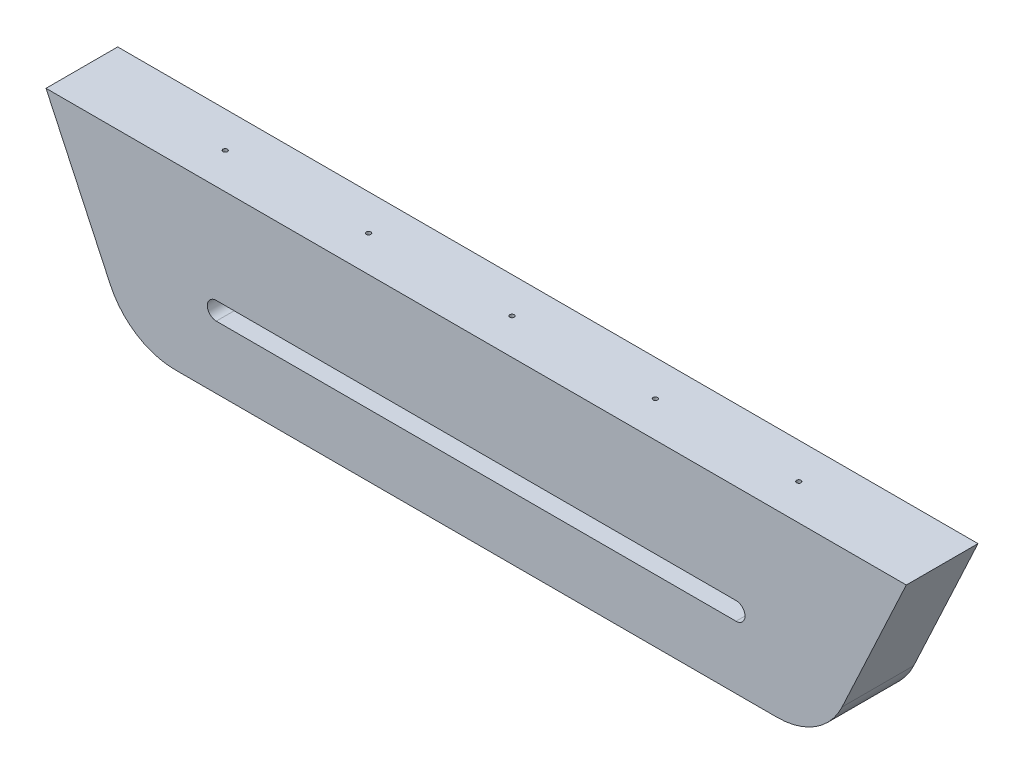
from build123d import *

# Parameters (mm, degrees)
BOSS_EXTRUDE1_DEPTH                = 25.4
FILLET1_R                          = 25.4
F_1_4_0_25_DIAMETER_SLOT1_DEPTH    = 25.4
F_1_16_0_0625_DIAMETER_HOLE1_D     = 1.5875
F_1_16_0_0625_DIAMETER_HOLE1_DEPTH = 12.7
F_1_16_0_0625_DIAMETER_HOLE1_TIP   = 0.476933116


# Read off the part's stored shape, not the designer's step: 1/4 (0.25) Diameter Slot1
with BuildPart() as part:
    # Sketch1 → Boss-Extrude1 (new body)
    with BuildSketch(Plane.XY):
        Polygon((-152.4, 0), (152.4, 0), (122.789463707, -63.5), (-122.789463707, -63.5), align=None)
    extrude(amount=BOSS_EXTRUDE1_DEPTH)

    # Fillet1
    fillet1_edges = [part.edges().sort_by_distance(p)[0] for p in [
        (122.789463707, -63.5, 12.7),
        (-122.789463707, -63.5, 12.7),
    ]]
    fillet(fillet1_edges, radius=FILLET1_R)

    # 1/4 (0.25) Diameter Slot1 outline → 1/4 (0.25) Diameter Slot1 (cut)
    with BuildSketch(Plane.XY):
        with BuildLine():
            Line((-92.075, -41.275), (92.075, -41.275))
            ThreePointArc((92.075, -41.275), (95.25, -38.1), (92.075, -34.925))
            Line((92.075, -34.925), (-92.075, -34.925))
            ThreePointArc((-92.075, -34.925), (-95.25, -38.1), (-92.075, -41.275))
        make_face()
    extrude(amount=F_1_4_0_25_DIAMETER_SLOT1_DEPTH, mode=Mode.SUBTRACT)

    # 1/16 (0.0625) Diameter Hole1
    with Locations(Plane(origin=(0, 0, 0), x_dir=(1, 0, 0), z_dir=(0, 1, 0))):
        with Locations((-101.6, -12.7), (-50.8, -12.7), (0, -12.7), (50.8, -12.7), (101.6, -12.7)):
            Hole(F_1_16_0_0625_DIAMETER_HOLE1_D / 2, depth=F_1_16_0_0625_DIAMETER_HOLE1_DEPTH)
            with Locations((0, 0, -(F_1_16_0_0625_DIAMETER_HOLE1_DEPTH + F_1_16_0_0625_DIAMETER_HOLE1_TIP / 2))):  # 118° drill point
                Cone(0, F_1_16_0_0625_DIAMETER_HOLE1_D / 2, F_1_16_0_0625_DIAMETER_HOLE1_TIP, mode=Mode.SUBTRACT)


solid = part.part
